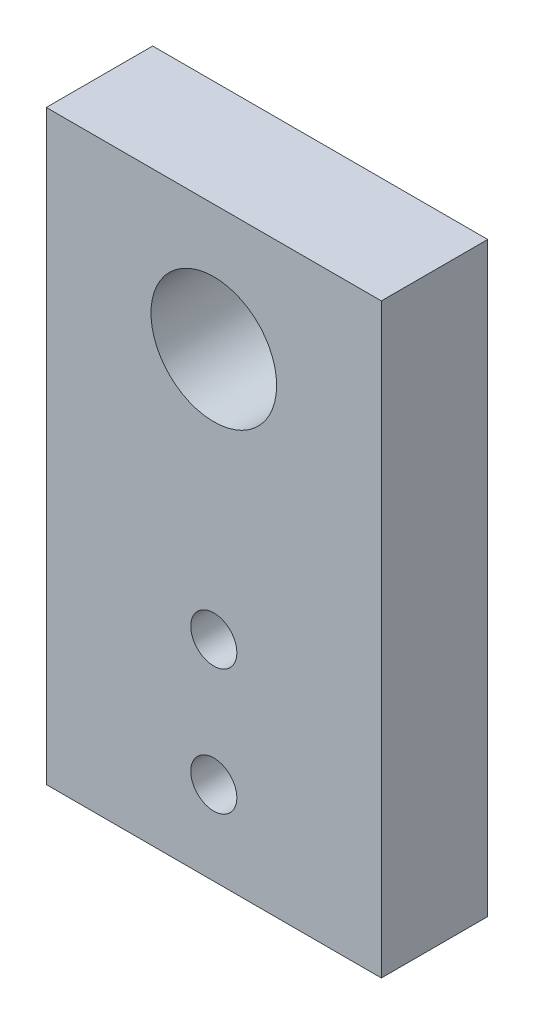
from build123d import *

# Parameters (mm, degrees)
SKETCH1_W            = 40
SKETCH1_H            = 70
SKETCH1_R            = 7.5
BOSS_EXTRUDE1_DEPTH  = 12.7
M5_CLEARANCE_HOLE1_D = 5.5


with BuildPart() as part:
    # Sketch1 → Boss-Extrude1 (new body)
    with BuildSketch(Plane.XY):
        Rectangle(SKETCH1_W, SKETCH1_H)
        with Locations((0, 20)):
            Circle(SKETCH1_R, mode=Mode.SUBTRACT)
    extrude(amount=BOSS_EXTRUDE1_DEPTH)

    # M5 Clearance Hole1 (through all)
    with Locations(Plane.XY.offset(12.7)):
        with Locations((0, -10), (0, -25)):
            Hole(M5_CLEARANCE_HOLE1_D / 2)


solid = part.part
